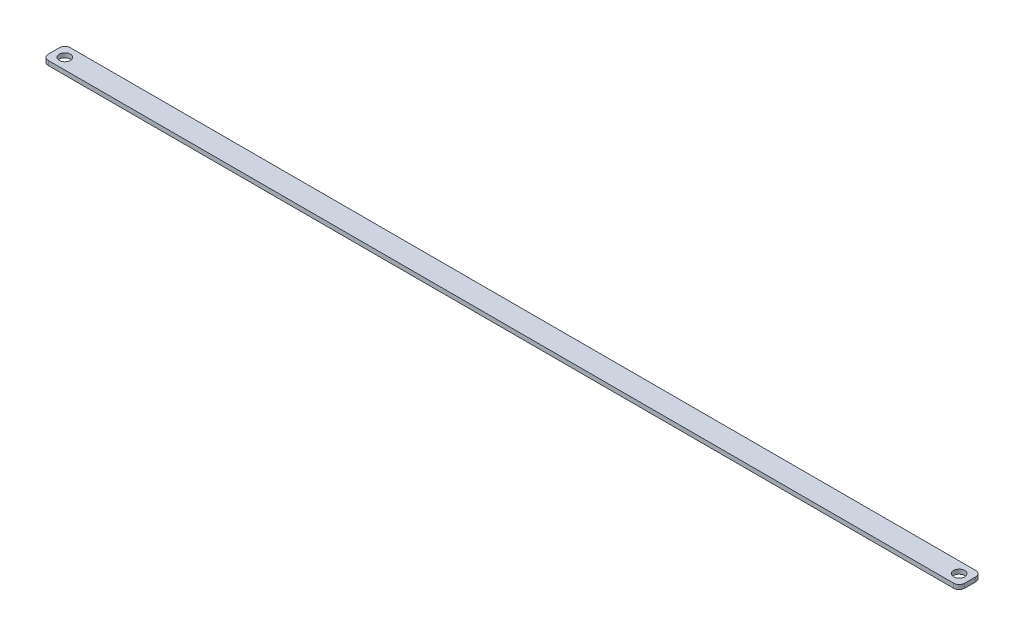
from build123d import *

# Parameters (mm, degrees)
SKETCH1_R           = 2.5
BOSS_EXTRUDE2_DEPTH = 2
FLEX1_OUTLINE_R     = 2.5
FLEX1_DEPTH         = 2


# Read off the part's stored shape, not the designer's step: Flex1
with BuildPart() as part:
    # Sketch1 → Boss-Extrude2 (new body)
    with BuildSketch(Plane(origin=(0, 0, 0), x_dir=(1, 0, 0), z_dir=(0, 1, 0))):
        with BuildLine():
            Line((2.5, 0), (47.5, 0))
            ThreePointArc((47.5, 0), (49.267766953, 0.732233047), (50, 2.5))
            Line((50, 2.5), (50, 7.5))
            ThreePointArc((50, 7.5), (49.267766953, 9.267766953), (47.5, 10))
            Line((47.5, 10), (2.5, 10))
            ThreePointArc((2.5, 10), (0.732233047, 9.267766953), (0, 7.5))
            Line((0, 7.5), (0, 2.5))
            ThreePointArc((0, 2.5), (0.732233047, 0.732233047), (2.5, 0))
        make_face()
        with Locations(Location((5, 5, 0), (0, 0, 270))):
            Circle(SKETCH1_R, mode=Mode.SUBTRACT)
        with Locations(Location((45, 5, 0), (0, 0, 270))):
            Circle(SKETCH1_R, mode=Mode.SUBTRACT)
    extrude(amount=BOSS_EXTRUDE2_DEPTH)

    # Flex1 outline → Flex1 (add)
    # profile 1 of 4: a face of its own
    with BuildSketch(Plane(origin=(0, 0, 0), x_dir=(1, 0, 0), z_dir=(0, 1, 0))):
        with BuildLine():
            Line((2.5, 10), (-175.592663933, 10))
            ThreePointArc((-175.592663933, 10), (-177.360430886, 9.267766953), (-178.092663933, 7.5))
            Line((-178.092663933, 7.5), (-178.092663933, 2.5))
            ThreePointArc((-178.092663933, 2.5), (-177.360430886, 0.732233047), (-175.592663933, 0))
            Line((-175.592663933, 0), (2.5, 0))
            ThreePointArc((2.5, 0), (0.732233047, 0.732233047), (0, 2.5))
            Line((0, 2.5), (0, 7.5))
            ThreePointArc((0, 7.5), (0.732233047, 9.267766953), (2.5, 10))
        make_face()
        with Locations((-173.092663933, 5)):
            Circle(FLEX1_OUTLINE_R, mode=Mode.SUBTRACT)
    # profile 2 of 4: a face of its own
    with BuildSketch(Plane(origin=(0, 0, 0), x_dir=(1, 0, 0), z_dir=(0, 1, 0))):
        with BuildLine():
            Line((234.407336067, 10), (47.5, 10))
            ThreePointArc((47.5, 10), (49.267766953, 9.267766953), (50, 7.5))
            Line((50, 7.5), (50, 2.5))
            ThreePointArc((50, 2.5), (49.267766953, 0.732233047), (47.5, 0))
            Line((47.5, 0), (234.407336067, 0))
            ThreePointArc((234.407336067, 0), (236.17510302, 0.732233047), (236.907336067, 2.5))
            Line((236.907336067, 2.5), (236.907336067, 7.5))
            ThreePointArc((236.907336067, 7.5), (236.17510302, 9.267766953), (234.407336067, 10))
        make_face()
        with Locations((231.907336067, 5)):
            Circle(FLEX1_OUTLINE_R, mode=Mode.SUBTRACT)
    # profile 3 of 4: a face of its own
    with BuildSketch(Plane(origin=(0, 0, 0), x_dir=(1, 0, 0), z_dir=(0, 1, 0))):
        with Locations((5, 5)):
            Circle(FLEX1_OUTLINE_R)
    # profile 4 of 4: a face of its own
    with BuildSketch(Plane(origin=(0, 0, 0), x_dir=(1, 0, 0), z_dir=(0, 1, 0))):
        with Locations((45, 5)):
            Circle(FLEX1_OUTLINE_R)
    extrude(amount=FLEX1_DEPTH)


solid = part.part
